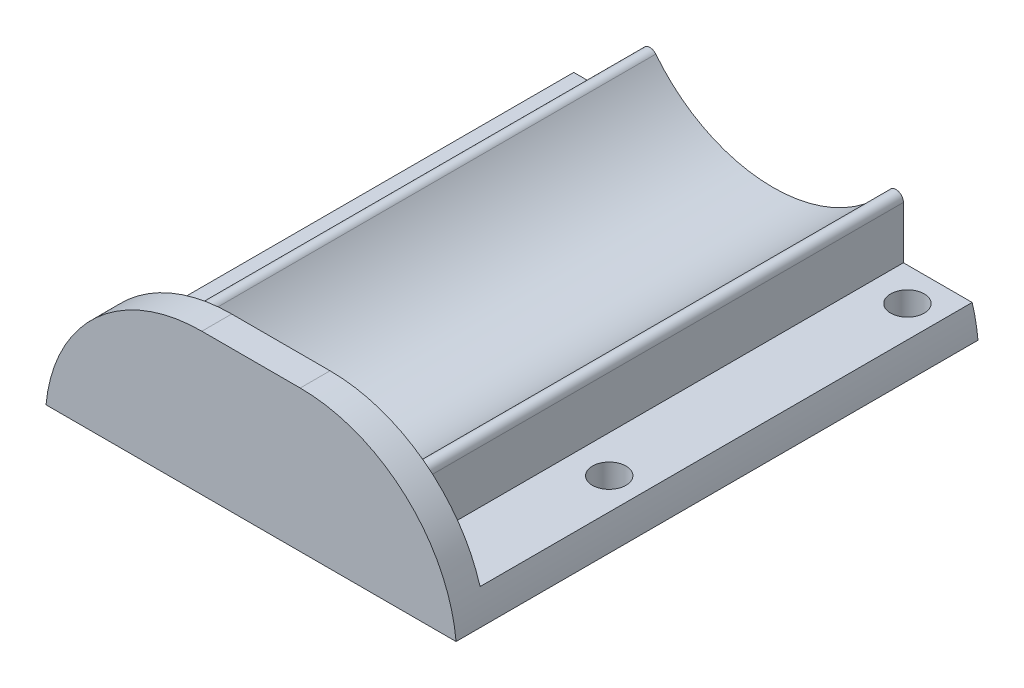
from build123d import *

# Parameters (mm, degrees)
SKETCH1_W            = 55
SKETCH1_H            = 70
BOSS_EXTRUDE1_DEPTH  = 4
M4_CLEARANCE_HOLE1_D = 4.5
BOSS_EXTRUDE2_DEPTH  = 70
SKETCH5_W            = 55
SKETCH5_H            = 4
BOSS_EXTRUDE3_DEPTH  = 15
FILLET1_R            = 1
FILLET2_START        = -36
FILLET2_DEPTH        = 71


with BuildPart() as part:
    # Sketch1 → Boss-Extrude1 (new body)
    with BuildSketch(Plane(origin=(0, 0, 0), x_dir=(1, 0, 0), z_dir=(0, 1, 0))):
        Rectangle(SKETCH1_W, SKETCH1_H)
    extrude(amount=BOSS_EXTRUDE1_DEPTH)

    # M4 Clearance Hole1 (through all)
    with Locations(Plane(origin=(0, 4, 0), x_dir=(1, 0, 0), z_dir=(0, 1, 0))):
        with Locations((-22.5, 30.536735359), (22.5, 30.536735359), (-22.5, -9.463264641), (22.5, -9.463264641)):
            Hole(M4_CLEARANCE_HOLE1_D / 2)

    # Sketch4 → Boss-Extrude2 (add, through all)
    with BuildSketch(Plane(origin=(0, 0, -35), x_dir=(-1, 0, 0), z_dir=(0, 0, -1))):
        with BuildLine():
            Line((-17.5, 14.317541634), (-17.5, 4))
            Line((-17.5, 4), (0, 4))
            ThreePointArc((0, 4), (-10.157530032, 6.771402156), (-17.5, 14.317541634))
        make_face()
        with BuildLine():
            ThreePointArc((17.5, 14.317541634), (10.157530032, 6.771402156), (0, 4))
            Line((0, 4), (17.5, 4))
            Line((17.5, 4), (17.5, 14.317541634))
        make_face()
    extrude(amount=-BOSS_EXTRUDE2_DEPTH)

    # Sketch5 → Boss-Extrude3 (add)
    with BuildSketch(Plane(origin=(0, 4, 0), x_dir=(1, 0, 0), z_dir=(0, 1, 0))):
        with Locations((0, -33)):
            Rectangle(SKETCH5_W, SKETCH5_H)
    extrude(amount=BOSS_EXTRUDE3_DEPTH)

    # Fillet1
    fillet1_edges = [part.edges().sort_by_distance(p)[0] for p in [
        (-17.5, 14.317541634, -2),
        (17.5, 14.317541634, -2),
    ]]
    fillet(fillet1_edges, radius=FILLET1_R)

    # Fillet2: read off the stored shape, not the designer's step
    # Fillet2 outline → Fillet2 (cut)
    with BuildSketch(Plane.XY.offset(FILLET2_START)):
        with BuildLine():
            ThreePointArc((-27.5, 0), (-20.719901931, 13.540270268), (-6.59545504, 19))
            Line((-6.59545504, 19), (-27.5, 19))
            Line((-27.5, 19), (-27.5, 0))
        make_face()
        with BuildLine():
            ThreePointArc((6.59545504, 19), (20.719901931, 13.540270268), (27.5, 0))
            Line((27.5, 0), (27.5, 19))
            Line((27.5, 19), (6.59545504, 19))
        make_face()
    extrude(amount=FILLET2_DEPTH, mode=Mode.SUBTRACT)


solid = part.part
